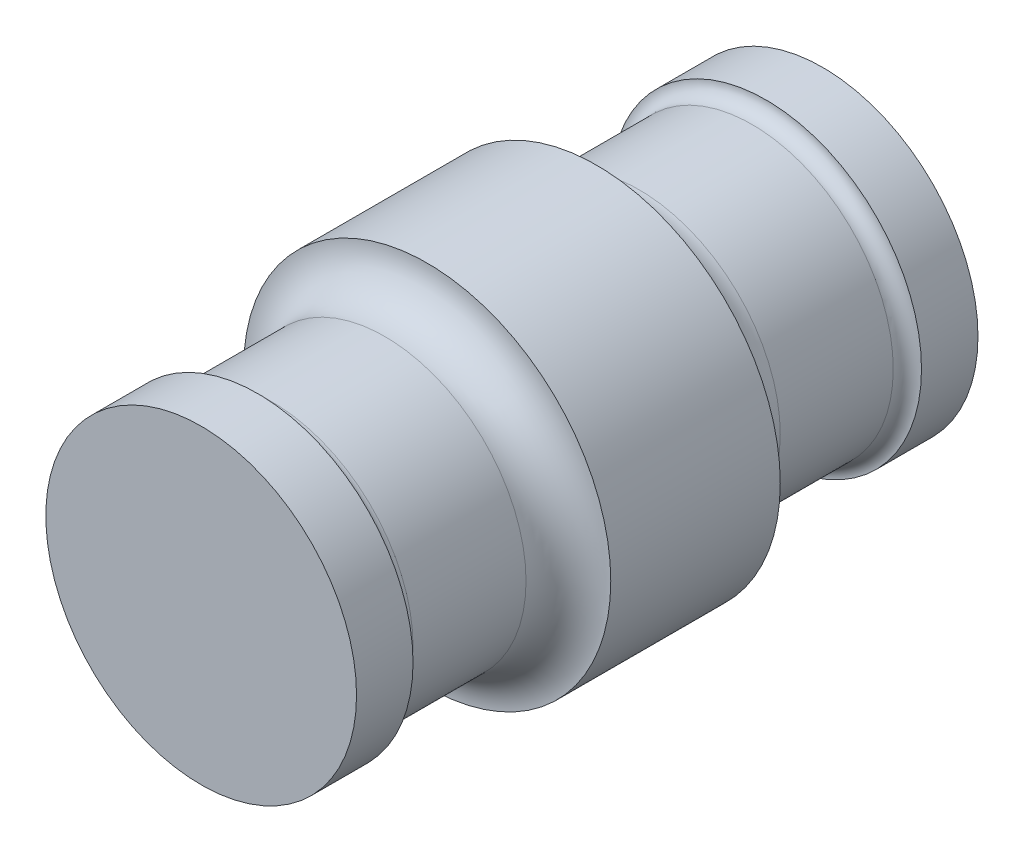
from build123d import *

# Parameters (mm, degrees)
SKETCH1_R           = 5
BOSS_EXTRUDE1_DEPTH = 6
BOSS_EXTRUDE2_START = -6
SKETCH1_3_R         = 6.5
SKETCH1_3_R_2       = 5
BOSS_EXTRUDE2_DEPTH = 6
BOSS_EXTRUDE3_START = -12
SKETCH1_4_R         = 5
BOSS_EXTRUDE3_DEPTH = 12
FILLET1_R           = 1.5
SKETCH3_R           = 5.5
BOSS_EXTRUDE4_DEPTH = 2
BOSS_EXTRUDE5_START = -20
SKETCH3_2_R         = 5.5
BOSS_EXTRUDE5_DEPTH = 2
FILLET2_R           = 0.5


with BuildPart() as part:
    # Sketch1 → Boss-Extrude1 (new body)
    with BuildSketch(Plane.XY):
        Circle(SKETCH1_R)
    extrude(amount=BOSS_EXTRUDE1_DEPTH)

    # Sketch1<3> → Boss-Extrude2 (add)
    # profile 1 of 2: a face of its own
    with BuildSketch(Plane.XY.offset(BOSS_EXTRUDE2_START)):
        Circle(SKETCH1_3_R)
        Circle(SKETCH1_3_R_2, mode=Mode.SUBTRACT)
    # profile 2 of 2: a face of its own
    with BuildSketch(Plane.XY.offset(BOSS_EXTRUDE2_START)):
        Circle(SKETCH1_3_R_2)
    extrude(amount=BOSS_EXTRUDE2_DEPTH)

    # Sketch1<4> → Boss-Extrude3 (add)
    with BuildSketch(Plane.XY.offset(BOSS_EXTRUDE3_START)):
        Circle(SKETCH1_4_R)
    extrude(amount=BOSS_EXTRUDE3_DEPTH)

    # Fillet1
    fillet1_edges = [part.edges().sort_by_distance(p)[0] for p in [
        (-5, 0, -6),
        (-5, 0, 0),
    ]]
    fillet(fillet1_edges, radius=FILLET1_R - 0.0001)  # a hair under: the kernel refuses the full size

    # Sketch3 → Boss-Extrude4 (add)
    with BuildSketch(Plane.XY.offset(6)):
        Circle(SKETCH3_R)
    extrude(amount=BOSS_EXTRUDE4_DEPTH)

    # Sketch3<2> → Boss-Extrude5 (add)
    with BuildSketch(Plane.XY.offset(6).offset(BOSS_EXTRUDE5_START)):
        Circle(SKETCH3_2_R)
    extrude(amount=BOSS_EXTRUDE5_DEPTH)

    # Fillet2
    fillet2_edges = [part.edges().sort_by_distance(p)[0] for p in [
        (-5, 0, -12),
        (-5, 0, 6),
    ]]
    fillet(fillet2_edges, radius=FILLET2_R - 0.0001)  # a hair under: the kernel refuses the full size


solid = part.part
